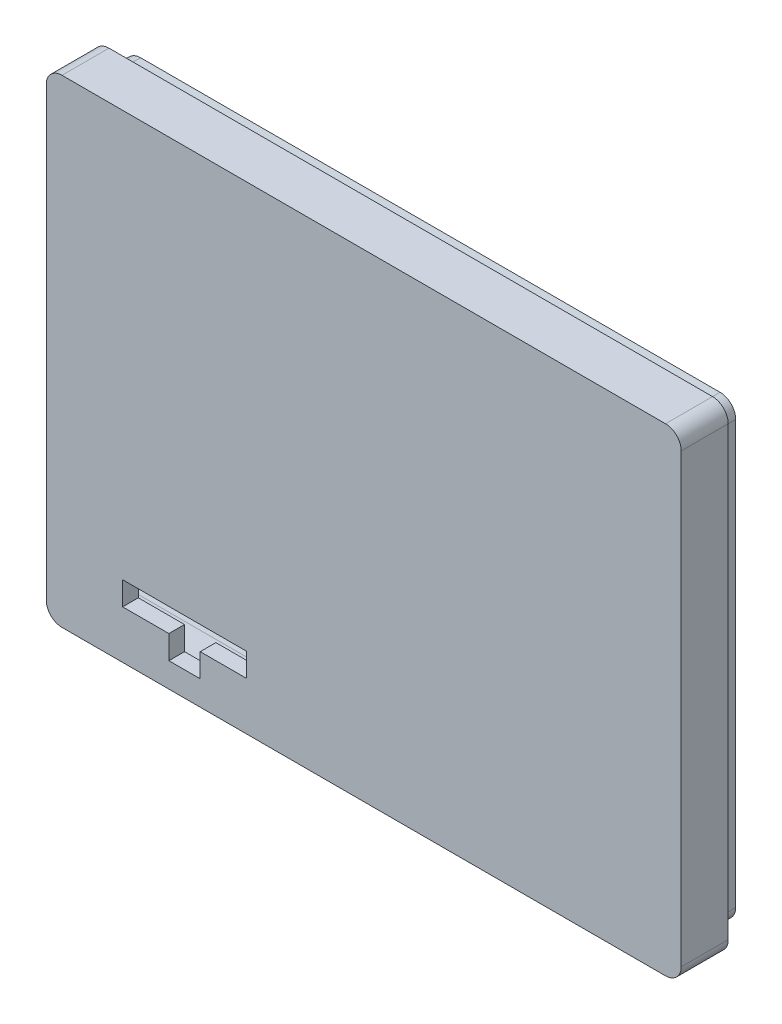
from build123d import *

# Parameters (mm, degrees)
ESQUISSE1_W                  = 81
ESQUISSE1_H                  = 61
ESQUISSE1_W_2                = 76
ESQUISSE1_H_2                = 56
EXTRU_MINCE1_DEPTH           = 6
ESQUISSE2_W                  = 78
ESQUISSE2_H                  = 58
ESQUISSE2_W_2                = 76
ESQUISSE2_H_2                = 56
EXTRU_MINCE2_DEPTH           = 6
EXTRU_MINCE2_OTHER_WAY_DEPTH = 2.5
EXTRU_MINCE2_OTHER_WAY_TAPER = 1
ESQUISSE3_W                  = 76
ESQUISSE3_H                  = 56
BOSS_EXTRU_1_DEPTH           = 2
CONG_1_R                     = 2
CONG_2_R                     = 2
ESQUISSE4_W                  = 10
ESQUISSE4_H                  = 6.5
ENL_V_MAT_EXTRU_1_DEPTH      = 12
ENL_V_MAT_EXTRU_2_DEPTH      = 1.5
ENL_V_MAT_EXTRU_3_DEPTH      = 11.5


with BuildPart() as part:
    # Esquisse1 → Extru.-Mince1 (new body)
    with BuildSketch(Plane.XY):
        with Locations((40.5, 30.5)):
            Rectangle(ESQUISSE1_W, ESQUISSE1_H)
        with Locations((40.5, 30.5)):
            Rectangle(ESQUISSE1_W_2, ESQUISSE1_H_2, mode=Mode.SUBTRACT)
    extrude(amount=EXTRU_MINCE1_DEPTH)

    # Esquisse2 → Extru.-Mince2 (add)
    with BuildSketch(Plane.XY):
        with Locations((40.5, 30.5)):
            Rectangle(ESQUISSE2_W, ESQUISSE2_H)
        with Locations((40.5, 30.5)):
            Rectangle(ESQUISSE2_W_2, ESQUISSE2_H_2, mode=Mode.SUBTRACT)
    extrude(amount=EXTRU_MINCE2_DEPTH)

    # Esquisse2 → Extru.-Mince2 other way (add)
    with BuildSketch(Plane.XY):
        with Locations((40.5, 30.5)):
            Rectangle(ESQUISSE2_W, ESQUISSE2_H)
        with Locations((40.5, 30.5)):
            Rectangle(ESQUISSE2_W_2, ESQUISSE2_H_2, mode=Mode.SUBTRACT)
    extrude(amount=-EXTRU_MINCE2_OTHER_WAY_DEPTH, taper=EXTRU_MINCE2_OTHER_WAY_TAPER)

    # Esquisse3 → Boss.-Extru.1 (add)
    with BuildSketch(Plane.XY.offset(6)):
        with Locations((40.5, 30.5)):
            Rectangle(ESQUISSE3_W, ESQUISSE3_H)
    extrude(amount=-BOSS_EXTRU_1_DEPTH)

    # Congé1
    cong_1_edges = [part.edges().sort_by_distance(p)[0] for p in [
        (1.521818831, 59.478181169, -1.25),
        (1.521818831, 1.521818831, -1.25),
        (79.478181169, 1.521818831, -1.25),
        (79.478181169, 59.478181169, -1.25),
    ]]
    fillet(cong_1_edges, radius=CONG_1_R)

    # Congé2
    cong_2_edges = [part.edges().sort_by_distance(p)[0] for p in [
        (81, 61, 3),
        (81, 0, 3),
        (0, 0, 3),
        (0, 61, 3),
    ]]
    fillet(cong_2_edges, radius=CONG_2_R)

    # Esquisse4 → Enlèv. mat.-Extru.1 (cut)
    with BuildSketch(Plane(origin=(0, 0, 0), x_dir=(0, 0, -1), z_dir=(1, 0, 0))):
        with Locations((1.75, 47.55)):
            Rectangle(ESQUISSE4_W, ESQUISSE4_H)
    extrude(amount=ENL_V_MAT_EXTRU_1_DEPTH, mode=Mode.SUBTRACT)

    # Esquisse5 → Enlèv. mat.-Extru.2 (cut)
    with BuildSketch(Plane(origin=(2.499238534, 0, -0.043624371), x_dir=(-0.01745240643728355, 0, -0.9998476951563913), z_dir=(0.9998476951563913, 0, -0.01745240643728355))):
        with BuildLine():
            Line((-0.043631016, 52.05), (9.11559923, 52.05))
            Line((9.11559923, 52.05), (9.11559923, 43.05))
            Line((9.11559923, 43.05), (-0.043631016, 43.05))
            ThreePointArc((-0.043631016, 43.05), (-4.543631016, 47.55), (-0.043631016, 52.05))
        make_face()
    extrude(amount=-ENL_V_MAT_EXTRU_2_DEPTH, mode=Mode.SUBTRACT)

    # Esquisse6 → Enlèv. mat.-Extru.3 (cut)
    with BuildSketch(Plane.XY):
        Polygon((25.54, 9.14), (9.74, 9.14), (9.74, 6.14), (15.64, 6.14), (15.64, 3.14), (19.64, 3.14), (19.64, 6.14), (25.54, 6.14), align=None)
    extrude(amount=ENL_V_MAT_EXTRU_3_DEPTH, mode=Mode.SUBTRACT)


solid = part.part
